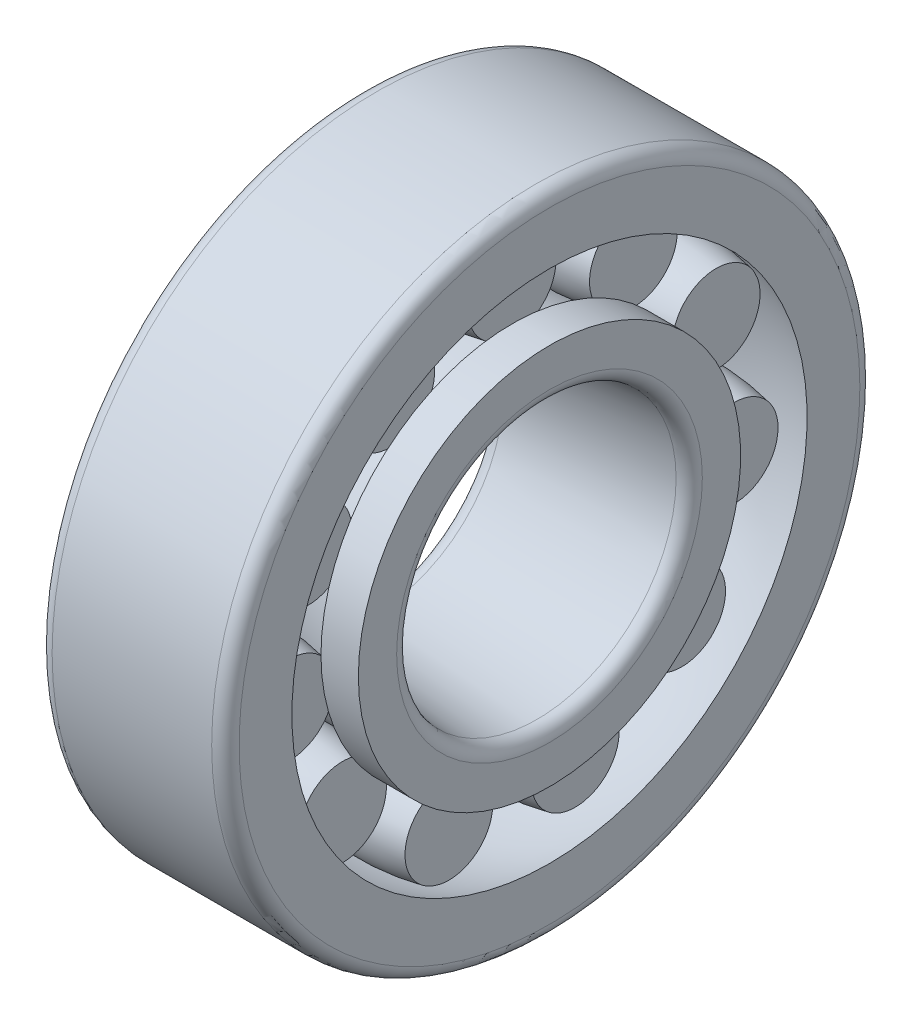
from build123d import *

# Parameters (mm, degrees)
CIRPATTERN3_COUNT = 11
FILLET1_R         = 1.1
FILLET2_R         = 1.1


# Read off the part's stored shape, not the designer's step: Draft4
with BuildPart() as part:
    # Sketch1 → Revolve1 (revolve)
    with BuildSketch(Plane.XY, mode=Mode.PRIVATE) as revolve1_sk:
        with BuildLine():
            Line((0, 26), (0, 20.666666667))
            ThreePointArc((0, 20.666666667), (7.5, 21.985475003), (15, 20.666666667))
            Line((15, 20.666666667), (15, 26))
            Line((15, 26), (0, 26))
        make_face()
        with BuildLine():
            Line((0, 15.333333333), (0, 10))
            Line((0, 10), (15, 10))
            Line((15, 10), (15, 15.333333333))
            Line((15, 15.333333333), (12, 15.333333333))
            Line((12, 15.333333333), (12, 14.479983478))
            ThreePointArc((12, 14.479983478), (7.5, 14.014524997), (3, 14.479983478))
            Line((3, 14.479983478), (3, 15.333333333))
            Line((3, 15.333333333), (0, 15.333333333))
        make_face()
    revolve(revolve1_sk.sketch.rotate(Axis((0, 0, 0), (1, 0, 0)), 90), axis=Axis((0, 0, 0), (1, 0, 0)))

    # Draft4 outline → Draft4 (revolve, cut)
    with BuildSketch(Plane.YX):
        Polygon((10, 15), (10, 0), (11.25, 15), align=None)
    revolve(axis=Axis((0, 0, 0), (1, 0, 0)), mode=Mode.SUBTRACT)

    # Fillet1
    fillet1_edges = [part.edges().sort_by_distance(p)[0] for p in [
        (0, 0, -26),
        (15, 0, -26),
    ]]
    fillet(fillet1_edges, radius=FILLET1_R)

    # Fillet2
    fillet2_edges = [part.edges().sort_by_distance(p)[0] for p in [
        (15, -11.25, 0),
        (0, -10, 0),
    ]]
    fillet(fillet2_edges, radius=FILLET2_R)


with BuildPart() as body_2:
    # Sketch3 → Revolve3 (revolve)
    with BuildSketch(Plane.XY, mode=Mode.PRIVATE) as revolve3_sk:
        with BuildLine():
            Line((12, 14.479983478), (12, 18))
            Line((12, 18), (3, 18))
            Line((3, 18), (3, 14.479983478))
            ThreePointArc((3, 14.479983478), (7.5, 14.014524997), (12, 14.479983478))
        make_face()
    revolve(revolve3_sk.sketch.rotate(Axis((12, 18, 0), (-1, 0, 0)), 180), axis=Axis((12, 18, 0), (-1, 0, 0)))


with BuildPart() as cirpattern3_1:
    # CirPattern3: pattern copy
    add(body_2.part.rotate(Axis((0, 0, 0), (1, 0, 0)), 1 * 360 / CIRPATTERN3_COUNT))


with BuildPart() as cirpattern3_2:
    # CirPattern3: pattern copy
    add(body_2.part.rotate(Axis((0, 0, 0), (1, 0, 0)), 2 * 360 / CIRPATTERN3_COUNT))


with BuildPart() as cirpattern3_3:
    # CirPattern3: pattern copy
    add(body_2.part.rotate(Axis((0, 0, 0), (1, 0, 0)), 3 * 360 / CIRPATTERN3_COUNT))


with BuildPart() as cirpattern3_4:
    # CirPattern3: pattern copy
    add(body_2.part.rotate(Axis((0, 0, 0), (1, 0, 0)), 4 * 360 / CIRPATTERN3_COUNT))


with BuildPart() as cirpattern3_5:
    # CirPattern3: pattern copy
    add(body_2.part.rotate(Axis((0, 0, 0), (1, 0, 0)), 5 * 360 / CIRPATTERN3_COUNT))


with BuildPart() as cirpattern3_6:
    # CirPattern3: pattern copy
    add(body_2.part.rotate(Axis((0, 0, 0), (1, 0, 0)), 6 * 360 / CIRPATTERN3_COUNT))


with BuildPart() as cirpattern3_7:
    # CirPattern3: pattern copy
    add(body_2.part.rotate(Axis((0, 0, 0), (1, 0, 0)), 7 * 360 / CIRPATTERN3_COUNT))


with BuildPart() as cirpattern3_8:
    # CirPattern3: pattern copy
    add(body_2.part.rotate(Axis((0, 0, 0), (1, 0, 0)), 8 * 360 / CIRPATTERN3_COUNT))


with BuildPart() as cirpattern3_9:
    # CirPattern3: pattern copy
    add(body_2.part.rotate(Axis((0, 0, 0), (1, 0, 0)), 9 * 360 / CIRPATTERN3_COUNT))


with BuildPart() as cirpattern3_10:
    # CirPattern3: pattern copy
    add(body_2.part.rotate(Axis((0, 0, 0), (1, 0, 0)), 10 * 360 / CIRPATTERN3_COUNT))


solid = Compound([part.part, body_2.part, cirpattern3_1.part, cirpattern3_2.part, cirpattern3_3.part, cirpattern3_4.part, cirpattern3_5.part, cirpattern3_6.part, cirpattern3_7.part, cirpattern3_8.part, cirpattern3_9.part, cirpattern3_10.part])
